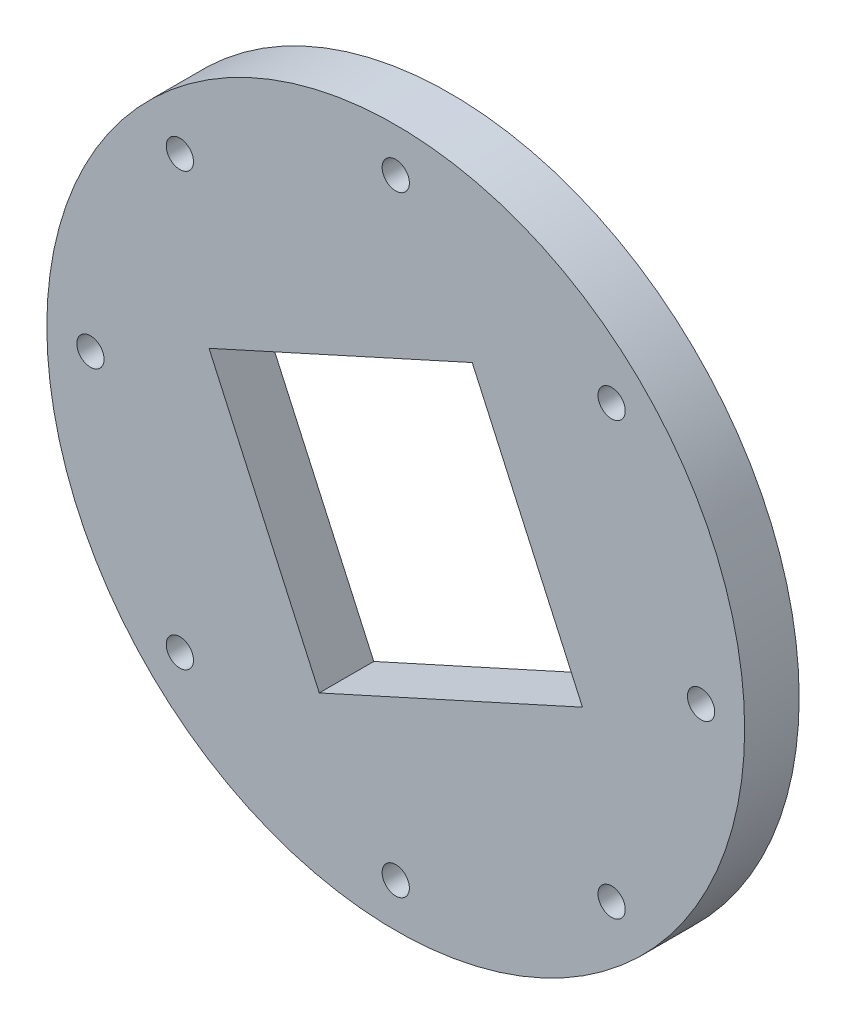
from build123d import *

# Parameters (mm, degrees)
CROQUIS1_R              = 32
SALIENTE_EXTRUIR1_DEPTH = 5
CROQUIS2_R              = 1.25
CORTAR_EXTRUIR1_DEPTH   = 46.530209751
CORTAR_EXTRUIR2_DEPTH   = 10


with BuildPart() as part:
    # Croquis1 → Saliente-Extruir1 (new body)
    with BuildSketch(Plane.XY):
        Circle(CROQUIS1_R)
    extrude(amount=SALIENTE_EXTRUIR1_DEPTH)

    # Croquis2 → Cortar-Extruir1 (cut, through all)
    with BuildSketch(Plane.XY.offset(5)):
        with Locations((0, 28)):
            Circle(CROQUIS2_R)
        with Locations((19.798989873, 19.798989873)):
            Circle(CROQUIS2_R)
        with Locations((28, 0)):
            Circle(CROQUIS2_R)
        with Locations((19.798989873, -19.798989873)):
            Circle(CROQUIS2_R)
        with Locations((0, -28)):
            Circle(CROQUIS2_R)
        with Locations((-19.798989873, -19.798989873)):
            Circle(CROQUIS2_R)
        with Locations((-28, 0)):
            Circle(CROQUIS2_R)
        with Locations((-19.798989873, 19.798989873)):
            Circle(CROQUIS2_R)
    extrude(amount=-CORTAR_EXTRUIR1_DEPTH, mode=Mode.SUBTRACT)

    # Croquis3 → Cortar-Extruir2 (cut)
    with BuildSketch(Plane.XY.offset(5)):
        Polygon((17.124606795, -5.68971371), (-7.013284565, -16.62645), (-17.124606795, 5.68971371), (7.013284565, 16.62645), align=None)
    extrude(amount=-CORTAR_EXTRUIR2_DEPTH, mode=Mode.SUBTRACT)


solid = part.part
